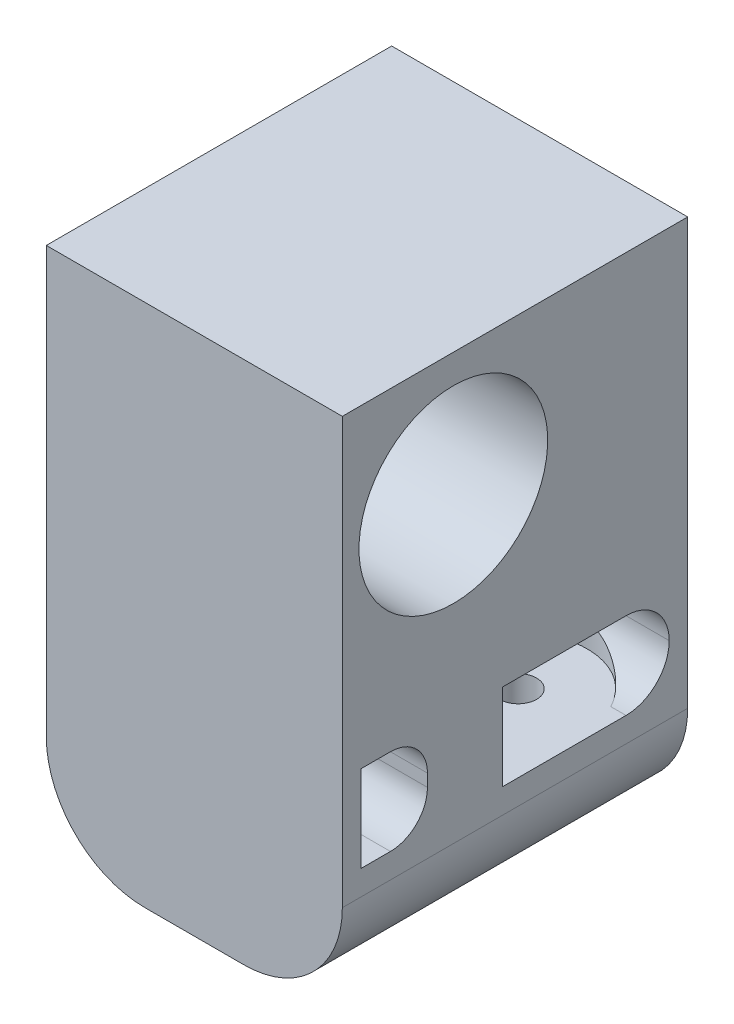
from build123d import *

# Parameters (mm, degrees)
SKETCH_1_W           = 24
SKETCH_1_H           = 36
EXTRUDE_1_DEPTH      = 19
CUT_EXTRUDE_2_DEPTH  = 3.5
SKETCH_4_W           = 5.4
SKETCH_4_H           = 7
CUT_EXTRUDE_3_DEPTH  = 36.510561809
CUT_EXTRUDE_4_DEPTH  = 3.5
SKETCH_6_R           = 4.15
CUT_EXTRUDE_5_DEPTH  = 44.726422218
FILLET_2_R           = 3
SKETCH_10_W          = 10
SKETCH_10_H          = 36
CUT_EXTRUDE_9_DEPTH  = 36.510561809
SKETCH_11_W          = 28
SKETCH_11_H          = 16.5
EXTRUDE_3_DEPTH      = 24
SKETCH_12_W          = 10.25
SKETCH_12_H          = 12
EXTRUDE_4_DEPTH      = 7
FILLET_3_R           = 3.5
SKETCH_13_W          = 10.25
SKETCH_13_H          = 1.5
EXTRUDE_5_DEPTH      = 7
FILLET_4_R           = 3.5
SKETCH_14_R          = 5.6
CUT_EXTRUDE_10_DEPTH = 7
FILLET_6_R           = 3
EXTRUDE_START        = -18
SKETCH_16_R          = 4.15
EXTRUDE_6_DEPTH      = 18
SKETCH_17_R          = 7.65
SKETCH_17_W          = 28
SKETCH_17_H          = 17.5
SKETCH_17_H_2        = 9
CUT_EXTRUDE_11_DEPTH = 47.122120558
FILLET_7_R           = 8
SKETCH_18_R          = 1.5
CUT_EXTRUDE_12_DEPTH = 26
SKETCH_19_R          = 1.5
CUT_EXTRUDE_13_DEPTH = 20
SKETCH_20_R          = 2.5
CUT_EXTRUDE_14_DEPTH = 1


with BuildPart() as part:
    # 草图1 → 凸台-拉伸1 (new, symmetric)
    with BuildSketch(Plane.XY):
        Rectangle(SKETCH_1_W, SKETCH_1_H)
    extrude(amount=EXTRUDE_1_DEPTH, both=True)

    # 草图3 → 切除-拉伸2 (cut, symmetric)
    with BuildSketch(Plane(origin=(0, 3.5, 0), x_dir=(1, 0, 0), z_dir=(0, 1, 0))):
        with BuildLine():
            Line((-5.75, -7.5), (-12, -7.5))
            Line((-12, -7.5), (-12, 19))
            Line((-12, 19), (1.75, 19))
            Line((1.75, 19), (1.75, 0))
            ThreePointArc((1.75, 0), (-0.446699141, -5.303300859), (-5.75, -7.5))
        make_face()
    extrude(amount=CUT_EXTRUDE_2_DEPTH, both=True, mode=Mode.SUBTRACT)

    # 草图4 → 切除-拉伸3 (cut, through all)
    with BuildSketch(Plane.ZY.offset(12)):
        with Locations((4.8, -3.5)):
            Rectangle(SKETCH_4_W, SKETCH_4_H)
    extrude(amount=-CUT_EXTRUDE_3_DEPTH, mode=Mode.SUBTRACT)

    # 草图5 → 切除-拉伸4 (cut, symmetric)
    with BuildSketch(Plane(origin=(0, -3.5, 0), x_dir=(1, 0, 0), z_dir=(0, 1, 0))):
        with BuildLine():
            Line((5.75, 4), (12, 4))
            Line((12, 4), (12, 19))
            Line((12, 19), (-1.75, 19))
            Line((-1.75, 19), (-1.75, 11.5))
            ThreePointArc((-1.75, 11.5), (0.446699141, 6.196699141), (5.75, 4))
        make_face()
    extrude(amount=CUT_EXTRUDE_4_DEPTH, both=True, mode=Mode.SUBTRACT)

    # 草图6 → 切除-拉伸5 (cut, through all)
    with BuildSketch(Plane(origin=(0, 0, -19), x_dir=(-1, 0, 0), z_dir=(0, 0, -1))):
        with Locations((0, 12)):
            Circle(SKETCH_6_R)
        with Locations(Location((0, -12, 0), (0, 0, 180))):
            Circle(SKETCH_6_R)
    extrude(amount=-CUT_EXTRUDE_5_DEPTH, mode=Mode.SUBTRACT)

    # 圆角2
    fillet_2_edges = [part.edges().sort_by_distance(p)[0] for p in [
        (6.725, 0, 2.1),
        (0, -7, 2.1),
    ]]
    fillet(fillet_2_edges, radius=FILLET_2_R)

    # 草图10 → 切除-拉伸9 (cut, through all)
    with BuildSketch(Plane(origin=(12, 0, 0), x_dir=(0, 0, -1), z_dir=(1, 0, 0))):
        with Locations((-14, 0)):
            Rectangle(SKETCH_10_W, SKETCH_10_H)
    extrude(amount=-CUT_EXTRUDE_9_DEPTH, mode=Mode.SUBTRACT)

    # 草图11 → 凸台-拉伸3 (add)
    with BuildSketch(Plane.ZY.offset(12)):
        with Locations((-5, -26.25)):
            Rectangle(SKETCH_11_W, SKETCH_11_H)
    extrude_3 = extrude(amount=-EXTRUDE_3_DEPTH)

    # 镜向2: 凸台-拉伸3 across plane
    add(extrude_3.mirror(Plane.ZX))

    # 草图12 → 凸台-拉伸4 (add)
    with BuildSketch(Plane(origin=(0, 0, 0), x_dir=(1, 0, 0), z_dir=(0, 1, 0))):
        with Locations((-6.875, 13)):
            Rectangle(SKETCH_12_W, SKETCH_12_H)
    extrude(amount=EXTRUDE_4_DEPTH)

    # 圆角3
    fillet_3_edges = [part.edges().sort_by_distance(p)[0] for p in [
        (-6.875, 0, -7),
        (-6.875, 7, -7),
    ]]
    fillet(fillet_3_edges, radius=FILLET_3_R - 0.0001)  # a hair under: the kernel refuses the full size

    # 草图13 → 凸台-拉伸5 (add)
    with BuildSketch(Plane.XZ):
        with Locations((6.875, -18.25)):
            Rectangle(SKETCH_13_W, SKETCH_13_H)
    extrude(amount=EXTRUDE_5_DEPTH)

    # 圆角4
    fillet_4_edges = [part.edges().sort_by_distance(p)[0] for p in [
        (6.875, 0, -17.5),
        (6.875, -7, -17.5),
    ]]
    fillet(fillet_4_edges, radius=FILLET_4_R - 0.0001)  # a hair under: the kernel refuses the full size

    # 草图14 → 切除-拉伸10 (cut)
    with BuildSketch(Plane.XZ):
        with Locations((5.75, -11.5)):
            Circle(SKETCH_14_R)
    extrude(amount=CUT_EXTRUDE_10_DEPTH, mode=Mode.SUBTRACT)

    # 圆角6
    fillet_6_edges = [part.edges().sort_by_distance(p)[0] for p in [
        (-5.275, 0, 2.1),
    ]]
    fillet(fillet_6_edges, radius=FILLET_6_R)

    # 草图16 → 凸台-拉伸6 (add)
    with BuildSketch(Plane.XY.offset(9).offset(EXTRUDE_START)):
        with Locations((0, -12)):
            Circle(SKETCH_16_R)
        with Locations(Location((0, 12, 0), (0, 0, 180))):
            Circle(SKETCH_16_R)
    extrude(amount=EXTRUDE_6_DEPTH)

    # 草图17 → 切除-拉伸11 (cut, through all)
    with BuildSketch(Plane.ZY.offset(12)):
        with Locations(Location((0, 15.5, 0), (0, 0, 270))):
            Circle(SKETCH_17_R)
        with Locations((-5, -25.75)):
            Rectangle(SKETCH_17_W, SKETCH_17_H)
        with Locations((-5, 30)):
            Rectangle(SKETCH_17_W, SKETCH_17_H_2)
    extrude(amount=-CUT_EXTRUDE_11_DEPTH, mode=Mode.SUBTRACT)

    # 圆角7
    fillet_7_edges = [part.edges().sort_by_distance(p)[0] for p in [
        (12, -17, -5),
        (-12, -17, -5),
    ]]
    fillet(fillet_7_edges, radius=FILLET_7_R)

    # 草图18 → 切除-拉伸12 (cut)
    with BuildSketch(Plane.XZ.offset(17)):
        with Locations((-5.75, 0)):
            Circle(SKETCH_18_R)
    extrude(amount=-CUT_EXTRUDE_12_DEPTH, mode=Mode.SUBTRACT)

    # 草图19 → 切除-拉伸13 (cut)
    with BuildSketch(Plane.XZ.offset(17)):
        with Locations((5.75, -11.5)):
            Circle(SKETCH_19_R)
    extrude(amount=-CUT_EXTRUDE_13_DEPTH, mode=Mode.SUBTRACT)

    # 草图20 → 切除-拉伸14 (cut)
    with BuildSketch(Plane.XZ.offset(17)):
        with Locations((5.75, -11.5)):
            Circle(SKETCH_20_R)
        with Locations((-5.75, 0)):
            Circle(SKETCH_20_R)
    extrude(amount=-CUT_EXTRUDE_14_DEPTH, mode=Mode.SUBTRACT)


solid = part.part
